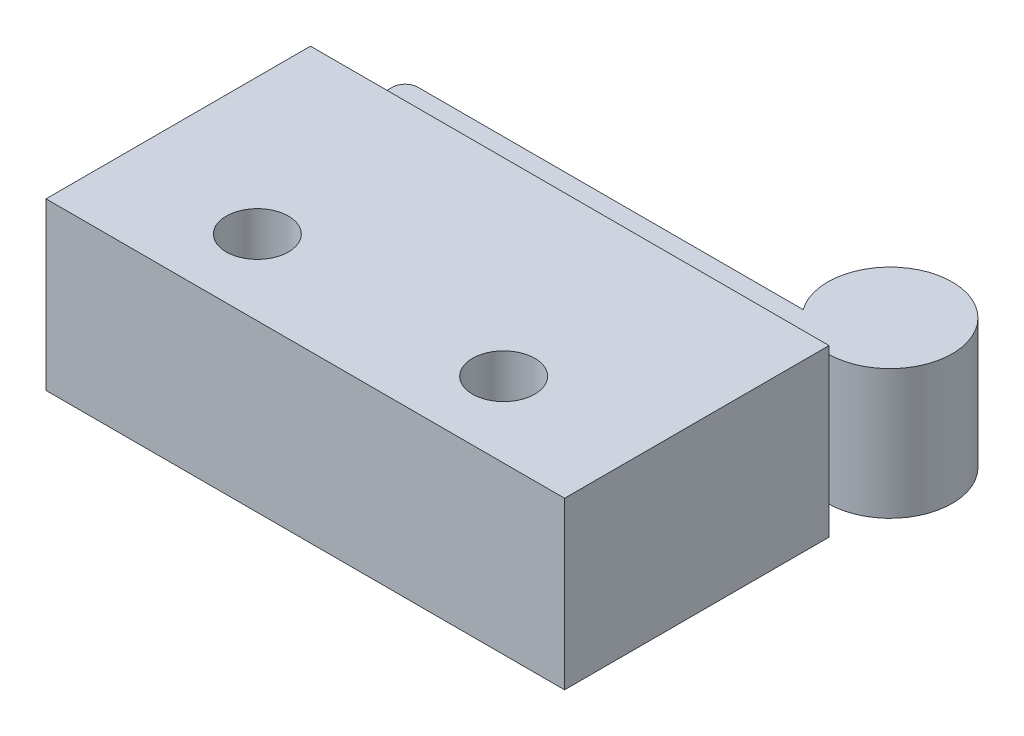
from build123d import *

# Parameters (mm, degrees)
SKETCH1_W           = 20
SKETCH1_H           = 10.2
SKETCH1_R           = 1.2
BOSS_EXTRUDE1_DEPTH = 6.4
BOSS_EXTRUDE2_DEPTH = 2.5
FILLET1_R           = 0.5


with BuildPart() as part:
    # Sketch1 → Boss-Extrude1 (new body)
    with BuildSketch(Plane(origin=(0, 0, 0), x_dir=(1, 0, 0), z_dir=(0, 1, 0))):
        Rectangle(SKETCH1_W, SKETCH1_H)
        with Locations(Location((-4.75, -2.2, 0), (0, 0, 270))):
            Circle(SKETCH1_R, mode=Mode.SUBTRACT)
        with Locations(Location((4.75, -2.2, 0), (0, 0, 270))):
            Circle(SKETCH1_R, mode=Mode.SUBTRACT)
    extrude(amount=BOSS_EXTRUDE1_DEPTH)

    # Sketch4 → Boss-Extrude2 (add, symmetric)
    with BuildSketch(Plane(origin=(0, 3.2, 0), x_dir=(1, 0, 0), z_dir=(0, 1, 0))):
        with BuildLine():
            Line((-6.75, 5.1), (-6.75, 5.5))
            Line((-6.75, 5.5), (9.55, 5.5))
            ThreePointArc((9.55, 5.5), (10.645445115, 10.03541565), (7.600641131, 6.5))
            Line((7.600641131, 6.5), (-7.75, 6.5))
            Line((-7.75, 6.5), (-7.75, 5.1))
            Line((-7.75, 5.1), (-6.75, 5.1))
        make_face()
    extrude(amount=BOSS_EXTRUDE2_DEPTH, both=True)

    # Fillet1
    # the kernel refuses this fillet: 0.5 mm, written as the material it adds along each edge
    with BuildSketch(Plane(origin=(-6.75, 0.7, -5.5), x_dir=(1.5765166949672097e-12, 0, 1.0), z_dir=(0, 1, 0))) as fillet1_piece_1:
        with BuildLine():
            CenterArc((0.5, 0.489897949), FILLET1_R, 180, 78.463040967)
            Line((0, 0.489897949), (0, 0))
            Line((0, 0), (0.4, 0))
        make_face()
    extrude(amount=5)
    # the kernel refuses this fillet: 0.5 mm, written as the material it takes off along each edge
    with BuildSketch(Plane(origin=(-7.75, 6.95, -6.5), x_dir=(0, 0, 1), z_dir=(0, -1, 0))) as fillet1_2_piece_1:
        with BuildLine():
            CenterArc((FILLET1_R, -FILLET1_R), FILLET1_R, 90, 90)
            Line((0, -FILLET1_R), (0, 0))
            Line((0, 0), (FILLET1_R, 0))
        make_face()
    extrude(amount=7.5, mode=Mode.SUBTRACT)


solid = part.part
